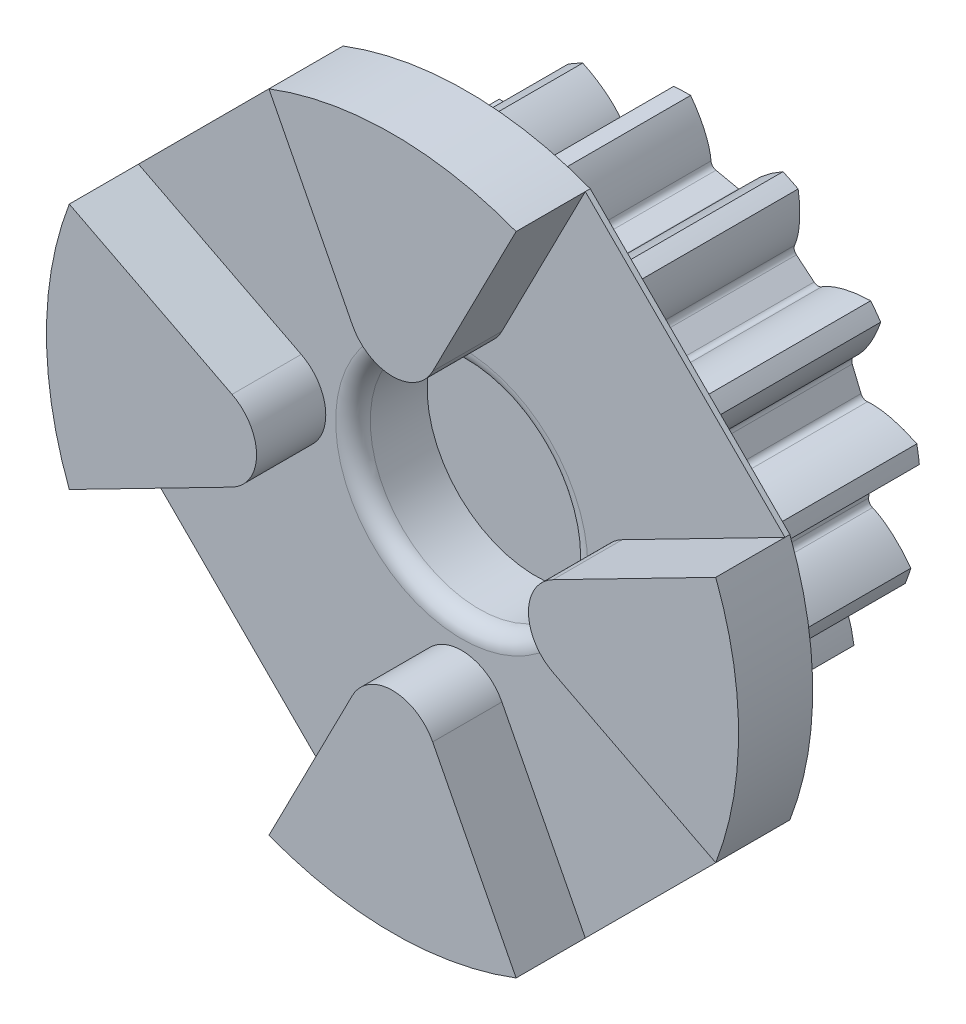
from build123d import *

# Parameters (mm, degrees)
SKETCH2_R                = 9.375
BOSS_EXTRUDE1_DEPTH      = 9
CUT_EXTRUDE1_DEPTH       = 9
FILLET1_R                = 0.254
CIRPATTERN3_COUNT        = 13
FILLET1_OF_CIRPATTERN3_R = 0.254
BOSS_EXTRUDE2_DEPTH      = 0.2
BOSS_EXTRUDE3_DEPTH      = 3
SKETCH7_R                = 4.4
CUT_EXTRUDE2_DEPTH       = 3
FILLET2_R                = 0.7


# Read off the part's stored shape, not the designer's step: Cut-Extrude1
with BuildPart() as part:
    # Sketch2 → Boss-Extrude1 (new body)
    with BuildSketch(Plane.XY):
        Circle(SKETCH2_R)
    extrude(amount=BOSS_EXTRUDE1_DEPTH)

    # Cut-Extrude1 outline → Cut-Extrude1 (cut)
    with BuildSketch(Plane.XY):
        with BuildLine():
            add(Edge.make_bspline(
                [(7.36375077, 0), (7.369196033, 0), (7.384464311, 0.000356691), (7.413295798, 0.002439252), (7.460189767, 0.007832738), (7.519640422, 0.017627369), (7.595991175, 0.033624104), (7.685169914, 0.056732319), (7.782202271, 0.086557444), (7.886545951, 0.123735009), (7.989429071, 0.164967118), (8.09080677, 0.209905809), (8.190585497, 0.258078866), (8.30989291, 0.320396761), (8.450705961, 0.400603876), (8.611688186, 0.502157362), (8.789753203, 0.626416136), (8.965954099, 0.762460936), (9.117866368, 0.889741099), (9.225406591, 0.987220267), (9.289799065, 1.047779957), (9.313674205, 1.070559573)],
                knots=[0, 0, 0, 0, 0, 0.005376748, 0.015083688, 0.02853182, 0.046610139, 0.064854849, 0.092110525, 0.119476175, 0.146842495, 0.174208853, 0.201574955, 0.228941013, 0.256307345, 0.307035032, 0.361767351, 0.41649966, 0.471231936, 0.525964281, 0.558682012, 0.558682012, 0.558682012, 0.558682012, 0.558682012], degree=4))
            Line((7.36375077, 0), (7.242514439, -1.330717849))
            add(Edge.make_bspline(
                [(8.966871537, -2.736026286), (8.947506025, -2.709307188), (8.895117565, -2.63810806), (8.806963529, -2.522799977), (8.680553382, -2.370162983), (8.531838369, -2.204516406), (8.37916005, -2.050124943), (8.239180156, -1.921152013), (8.115179827, -1.81681882), (8.009098273, -1.733966647), (7.919667745, -1.668555498), (7.828080081, -1.606036512), (7.734341957, -1.546891035), (7.638434616, -1.491469409), (7.54838955, -1.444600415), (7.464854976, -1.405756987), (7.392652058, -1.376226127), (7.335950201, -1.355849309), (7.29080296, -1.342070321), (7.262822496, -1.334811852), (7.247870052, -1.331701873), (7.242514439, -1.330717849)],
                knots=[0.350408904, 0.350408904, 0.350408904, 0.350408904, 0.350408904, 0.383126635, 0.43785898, 0.492591256, 0.547323565, 0.602055884, 0.652783571, 0.680149903, 0.707515961, 0.734882063, 0.762248421, 0.789614741, 0.816980391, 0.844236067, 0.862480777, 0.880559096, 0.894007228, 0.903714168, 0.909090916, 0.909090916, 0.909090916, 0.909090916, 0.909090916], degree=4))
            ThreePointArc((8.966871537, -2.736026286), (9.336332906, -0.850595595), (9.313674205, 1.070559573))
        make_face()
    cut_extrude1 = extrude(amount=CUT_EXTRUDE1_DEPTH, mode=Mode.SUBTRACT)

    # Fillet1
    fillet1_edges = [part.edges().sort_by_distance(p)[0] for p in [
        (7.242514439, -1.330717849, 4.5),
        (7.36375077, 0, 4.5),
    ]]
    fillet(fillet1_edges, radius=FILLET1_R)

    # CirPattern3: Cut-Extrude1 ×13 about axis
    cirpattern3_axis = Axis((0, 0, 18.908609159), (0, 0, -1))
    for i in range(1, CIRPATTERN3_COUNT):
        add(cut_extrude1.rotate(cirpattern3_axis, i * 360 / CIRPATTERN3_COUNT), mode=Mode.SUBTRACT)

    # Fillet1 of CirPattern3
    fillet1_of_cirpattern3_edges = [part.edges().sort_by_distance(p)[0] for p in [
        (5.794512631, -4.544056422, 4.5),
        (6.520277491, -3.422105616, 4.5),
        (3.019057811, -6.71640643, 4.5),
        (4.183087216, -6.060248076, 4.5),
        (-0.44802677, -7.350108666, 4.5),
        (0.887602072, -7.310060736, 4.5),
        (-3.812473818, -6.299989586, 4.5),
        (-2.61122201, -6.885226577, 4.5),
        (-6.303529059, -3.806618814, 4.5),
        (-5.511846598, -4.883069985, 4.5),
        (-7.350521758, -0.441197547, 4.5),
        (-7.149773556, -1.762260907, 4.5),
        (-6.713598506, 3.025296761, 4.5),
        (-7.149773556, 1.762260907, 4.5),
        (-4.538670744, 5.79873204, 4.5),
        (-5.511846598, 4.883069985, 4.5),
        (-1.323988211, 7.243747691, 4.5),
        (-2.61122201, 6.885226577, 4.5),
        (2.194004065, 7.029308043, 4.5),
        (0.887602072, 7.310060736, 4.5),
        (5.20937645, 5.204538634, 4.5),
        (4.183087216, 6.060248076, 4.5),
        (7.031343471, 2.187472146, 4.5),
        (6.520277491, 3.422105616, 4.5),
    ]]
    fillet(fillet1_of_cirpattern3_edges, radius=FILLET1_OF_CIRPATTERN3_R)

    # Sketch5 → Revolve1 (revolve)
    with BuildSketch(Plane(origin=(0, 0, 0), x_dir=(0, 0, -1), z_dir=(1, 0, 0))):
        Polygon((0, 3.25), (1, 3.25), (1, 2.25), (2, 2.25), (2, 0), (0, 0), align=None)
    revolve(axis=Axis((0, 0, -2), (0, 0, 1)))

    # Sketch6 → Boss-Extrude2 (add)
    with BuildSketch(Plane.XY.offset(9)):
        with BuildLine():
            Line((-13.076696831, -5), (-5, -13.076696831))
            ThreePointArc((-5, -13.076696831), (0, -14), (5, -13.076696831))
            Line((5, -13.076696831), (13.076696831, -5))
            ThreePointArc((13.076696831, -5), (14, 0), (13.076696831, 5))
            Line((13.076696831, 5), (5, 13.076696831))
            ThreePointArc((5, 13.076696831), (0, 14), (-5, 13.076696831))
            Line((-5, 13.076696831), (-13.076696831, 5))
            ThreePointArc((-13.076696831, 5), (-14, 0), (-13.076696831, -5))
        make_face()
    extrude(amount=BOSS_EXTRUDE2_DEPTH)

    # Sketch6<3> → Boss-Extrude3 (add)
    with BuildSketch(Plane.XY.offset(9)):
        with BuildLine():
            ThreePointArc((5, 13.076696831), (0, 14), (-5, 13.076696831))
            Line((-5, 13.076696831), (-1.625, 6.493048952))
            ThreePointArc((-1.625, 6.493048952), (0, 5.5), (1.625, 6.493048952))
            Line((1.625, 6.493048952), (5, 13.076696831))
        make_face()
        with BuildLine():
            Line((-6.493048952, 1.625), (-13.076696831, 5))
            ThreePointArc((-13.076696831, 5), (-14, 0), (-13.076696831, -5))
            Line((-13.076696831, -5), (-6.493048952, -1.625))
            ThreePointArc((-6.493048952, -1.625), (-5.5, 0), (-6.493048952, 1.625))
        make_face()
        with BuildLine():
            ThreePointArc((13.076696831, -5), (14, 0), (13.076696831, 5))
            Line((13.076696831, 5), (6.493048952, 1.625))
            ThreePointArc((6.493048952, 1.625), (5.5, 0), (6.493048952, -1.625))
            Line((6.493048952, -1.625), (13.076696831, -5))
        make_face()
        with BuildLine():
            Line((-1.625, -6.493048952), (-5, -13.076696831))
            ThreePointArc((-5, -13.076696831), (0, -14), (5, -13.076696831))
            Line((5, -13.076696831), (1.625, -6.493048952))
            ThreePointArc((1.625, -6.493048952), (0, -5.5), (-1.625, -6.493048952))
        make_face()
    extrude(amount=BOSS_EXTRUDE3_DEPTH)

    # Sketch7 → Cut-Extrude2 (cut)
    with BuildSketch(Plane.XY.offset(9.2)):
        Circle(SKETCH7_R)
    extrude(amount=-CUT_EXTRUDE2_DEPTH, mode=Mode.SUBTRACT)

    # Fillet2
    fillet2_edges = [part.edges().sort_by_distance(p)[0] for p in [
        (-4.4, 0, 9.2),
    ]]
    fillet(fillet2_edges, radius=FILLET2_R)


solid = part.part
